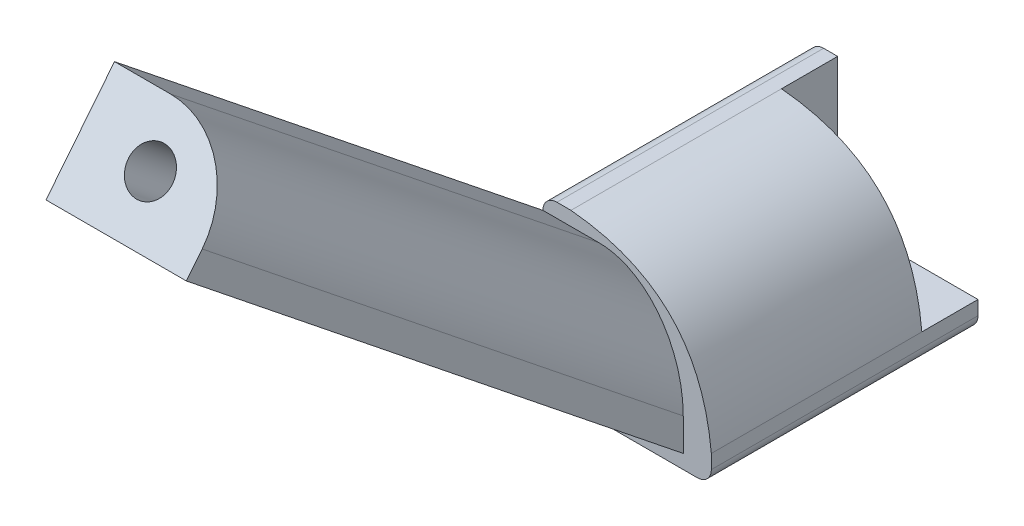
from build123d import *

# Parameters (mm, degrees)
SKETCH1_R                = 3.1115
BOSS_EXTRUDE1_DEPTH      = 3.81
BOSS_EXTRUDE2_DEPTH      = 5.08
BOSS_EXTRUDE2_DEPTH_BACK = 3.81
BOSS_EXTRUDE3_START      = 2.54
SKETCH3_R                = 1.2
BOSS_EXTRUDE3_DEPTH      = 2.54
BOSS_EXTRUDE4_START      = 12.7
SKETCH4_R                = 3.175
BOSS_EXTRUDE4_DEPTH      = 12.7
BOSS_EXTRUDE5_DEPTH      = 12.7
SKETCH7_R                = 3.1115
CUT_EXTRUDE1_DEPTH       = 64.134377028
SKETCH9_R                = 2.000000064
CUT_EXTRUDE2_DEPTH       = 6.99999997
FILLET1_R                = 7.62


with BuildPart() as part:
    # Sketch1 → Boss-Extrude1 (new body)
    with BuildSketch(Plane.XY):
        with BuildLine():
            Line((0, 0), (12.7, 0))
            add(Edge.make_bspline(
                [(0, 12.7), (11.620302725, 11.620302725), (12.7, 0)],
                knots=[0, 0, 0, 1, 1, 1], degree=2))
            Line((0, 12.7), (0, 0))
        make_face()
        with Locations(Location((5.08, 5.08, 0), (0, 0, 180))):
            Circle(SKETCH1_R, mode=Mode.SUBTRACT)
    extrude(amount=BOSS_EXTRUDE1_DEPTH)

    # Sketch2 → Boss-Extrude2 (add, two sides: drawn at the far end of the back side and taken through both)
    with BuildSketch(Plane(origin=(0, 0, 0), x_dir=(-1, 0, 0), z_dir=(0, 0, -1)).offset(-BOSS_EXTRUDE2_DEPTH_BACK)):
        with BuildLine():
            Line((0, 12.7), (1.27, 12.7))
            ThreePointArc((1.27, 12.7), (2.168025612, 12.328025612), (2.54, 11.43))
            Line((2.54, 11.43), (2.54, -1.27))
            ThreePointArc((2.54, -1.27), (2.168025612, -2.168025612), (1.27, -2.54))
            Line((1.27, -2.54), (-11.43, -2.54))
            ThreePointArc((-11.43, -2.54), (-12.328025612, -2.168025612), (-12.7, -1.27))
            Line((-12.7, -1.27), (-12.7, 0))
            Line((-12.7, 0), (0, 0))
            Line((0, 0), (0, 12.7))
        make_face()
    extrude(amount=BOSS_EXTRUDE2_DEPTH + BOSS_EXTRUDE2_DEPTH_BACK)

    # Sketch3 → Boss-Extrude3 (add)
    with BuildSketch(Plane.XY.offset(3.81).offset(BOSS_EXTRUDE3_START)):
        with BuildLine():
            Line((-2.54, 11.43), (-2.54, -1.27))
            ThreePointArc((-2.54, -1.27), (-2.168025612, -2.168025612), (-1.27, -2.54))
            Line((-1.27, -2.54), (11.43, -2.54))
            ThreePointArc((11.43, -2.54), (12.328025612, -2.168025612), (12.7, -1.27))
            Line((12.7, -1.27), (12.7, 0))
            add(Edge.make_bspline(
                [(0, 12.7), (11.620302725, 11.620302725), (12.7, 0)],
                knots=[0, 0, 0, 1, 1, 1], degree=2))
            Line((0, 12.7), (-1.27, 12.7))
            ThreePointArc((-1.27, 12.7), (-2.168025612, 12.328025612), (-2.54, 11.43))
        make_face()
        with Locations((5.08, 5.08)):
            Circle(SKETCH3_R, mode=Mode.SUBTRACT)
    extrude(amount=-BOSS_EXTRUDE3_DEPTH)

    # Sketch4 → Boss-Extrude4 (add)
    with BuildSketch(Plane.XY.offset(6.35).offset(BOSS_EXTRUDE4_START)):
        with BuildLine():
            Line((-2.54, 11.43), (-2.54, -1.27))
            ThreePointArc((-2.54, -1.27), (-2.168025612, -2.168025612), (-1.27, -2.54))
            Line((-1.27, -2.54), (11.43, -2.54))
            ThreePointArc((11.43, -2.54), (12.328025612, -2.168025612), (12.7, -1.27))
            Line((12.7, -1.27), (12.7, 0))
            add(Edge.make_bspline(
                [(0, 12.7), (11.620302725, 11.620302725), (12.7, 0)],
                knots=[0, 0, 0, 1, 1, 1], degree=2))
            Line((0, 12.7), (-1.27, 12.7))
            ThreePointArc((-1.27, 12.7), (-2.168025612, 12.328025612), (-2.54, 11.43))
        make_face()
        with Locations((5.08, 5.08)):
            Circle(SKETCH4_R, mode=Mode.SUBTRACT)
    extrude(amount=-BOSS_EXTRUDE4_DEPTH)

    # Sketch8 → Boss-Extrude5 (add)
    with BuildSketch(Plane.ZY.offset(2.54)):
        Polygon((19.05, 11.43), (19.05, -1.27), (64.010676082, 34.724533506), (57.814573212, 42.464069123), align=None)
    extrude(amount=-BOSS_EXTRUDE5_DEPTH)

    # Sketch7 → Cut-Extrude1 (cut, through all)
    with BuildSketch(Plane.XY.offset(19.05)):
        with Locations(Location((5.08, 5.08, 0), (0, 0, 180))):
            Circle(SKETCH7_R)
    extrude(amount=CUT_EXTRUDE1_DEPTH, mode=Mode.SUBTRACT)

    # Sketch9 → Cut-Extrude2 (cut)
    with BuildSketch(Plane(origin=(0, 44.792641372, 55.95036922), x_dir=(1, 0, 0), z_dir=(0, 0.624970196645459, 0.7806486106469008))):
        with Locations(Location((3.81, -7.939987304, 0), (0, 0, 270))):
            Circle(SKETCH9_R)
    extrude(amount=-CUT_EXTRUDE2_DEPTH, mode=Mode.SUBTRACT)

    # Fillet1
    # the kernel refuses this fillet: 7.62 mm, written as the material it takes off along each edge
    with BuildSketch(Plane(origin=(10.16, 54.369751369, 72.685929245), x_dir=(0, -0.7806486106469015, 0.6249701966454579), z_dir=(0, -0.6249701966454579, -0.7806486106469015))) as fillet1_piece_1_section:
        with BuildLine():
            CenterArc((FILLET1_R, FILLET1_R), FILLET1_R, 180, 90)
            Line((0, FILLET1_R), (0, 0))
            Line((0, 0), (FILLET1_R, 0))
        make_face()
    fillet1_piece_1 = extrude(amount=87.756878503, mode=Mode.PRIVATE)
    fillet1_piece_1 = split(fillet1_piece_1, bisect_by=Plane(origin=(8.453079593, 31.089805897, 19.05), z_dir=(0, 0, 1)), keep=Keep.TOP, mode=Mode.PRIVATE)
    add(fillet1_piece_1, mode=Mode.SUBTRACT)


solid = part.part
